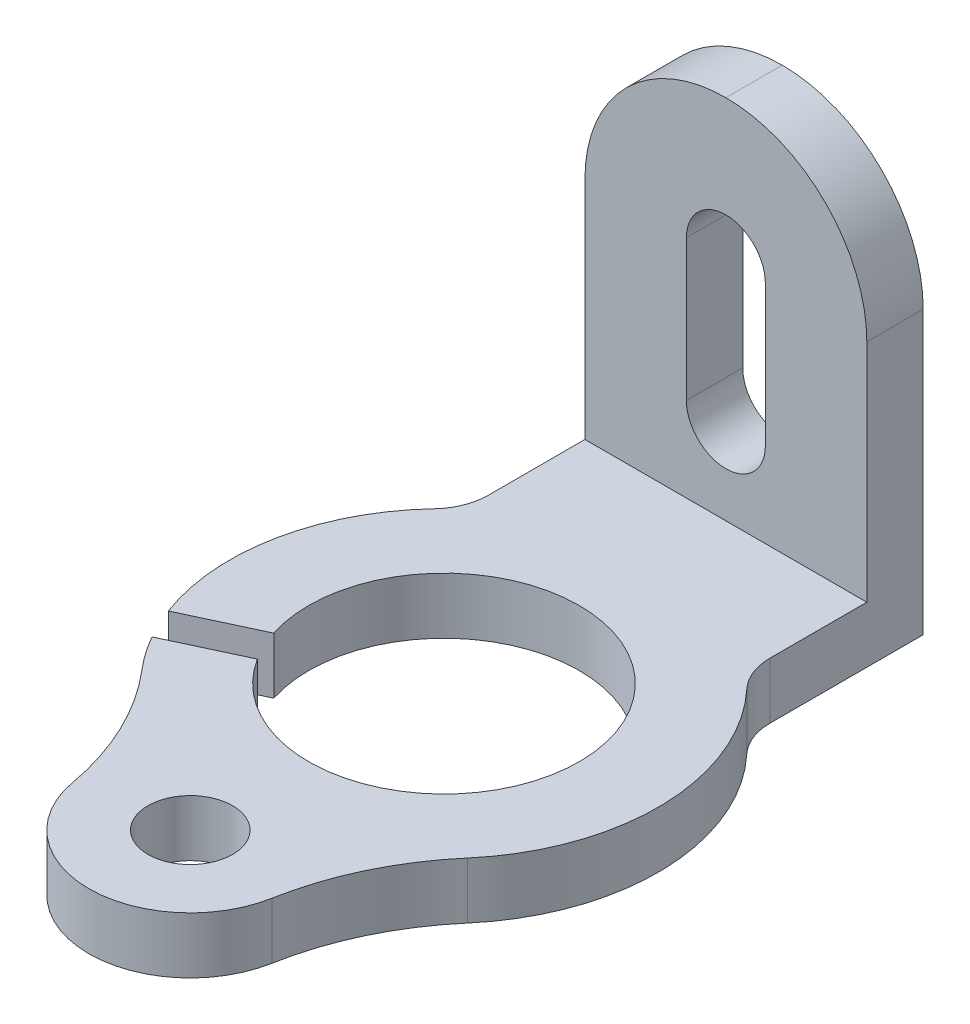
from build123d import *

# Parameters (mm, degrees)
SKETCH1_W           = 50
SKETCH1_H           = 10
SKETCH1_R           = 7.5
BOSS_EXTRUDE1_DEPTH = 10
SKETCH1_3_W         = 50
SKETCH1_3_H         = 10
BOSS_EXTRUDE2_DEPTH = 75
CUT_EXTRUDE1_DEPTH  = 10
FILLET1_R           = 25


with BuildPart() as part:
    # Sketch1 → Boss-Extrude1 (new body)
    # profile 1 of 3: a face of its own
    with BuildSketch(Plane(origin=(0, 0, 0), x_dir=(1, 0, 0), z_dir=(0, 1, 0))):
        with BuildLine():
            Line((25, -17.151864589), (25, 0))
            Line((25, 0), (-25, 0))
            Line((-25, 0), (-25, -17.151864589))
            ThreePointArc((-25, -17.151864589), (-25.701702665, -20.83176495), (-27.708333333, -23.995226133))
            ThreePointArc((-27.708333333, -23.995226133), (0, -12), (27.708333333, -23.995226133))
            ThreePointArc((27.708333333, -23.995226133), (25.701702665, -20.83176495), (25, -17.151864589))
        make_face()
    # profile 2 of 3: a face of its own
    with BuildSketch(Plane(origin=(0, 0, 0), x_dir=(1, 0, 0), z_dir=(0, 1, 0))):
        with Locations((0, 5)):
            Rectangle(SKETCH1_W, SKETCH1_H)
    # profile 3 of 3: a face of its own
    with BuildSketch(Plane(origin=(0, 0, 0), x_dir=(1, 0, 0), z_dir=(0, 1, 0))):
        with BuildLine():
            ThreePointArc((35.600057015, -63.29044546), (37.256095308, -42.517796957), (27.708333333, -23.995226133))
            ThreePointArc((27.708333333, -23.995226133), (0, -12), (-27.708333333, -23.995226133))
            ThreePointArc((-27.708333333, -23.995226133), (-37.256095308, -42.517796957), (-35.600057015, -63.29044546))
            Line((-35.600057015, -63.29044546), (-22.848639927, -57.34436202))
            ThreePointArc((-22.848639927, -57.34436202), (21.751386889, -39.857161718), (-20.312930357, -62.782208742))
            Line((-20.312930357, -62.782208742), (-33.064347445, -68.728292182))
            ThreePointArc((-33.064347445, -68.728292182), (-31.119955968, -71.807070885), (-28.889805354, -74.685606061))
            ThreePointArc((-28.889805354, -74.685606061), (-21.739686255, -85.712027428), (-17.709540124, -98.220588235))
            ThreePointArc((-17.709540124, -98.220588235), (0, -113), (17.709540124, -98.220588235))
            ThreePointArc((17.709540124, -98.220588235), (21.739686255, -85.712027428), (28.889805354, -74.685606061))
            ThreePointArc((28.889805354, -74.685606061), (31.119955968, -71.807070885), (33.064347445, -68.728292182))
            ThreePointArc((33.064347445, -68.728292182), (34.439695907, -66.059493946), (35.600057015, -63.29044546))
        make_face()
        with Locations(Location((0, -95, 0), (0, 0, 270))):
            Circle(SKETCH1_R, mode=Mode.SUBTRACT)
    extrude(amount=BOSS_EXTRUDE1_DEPTH)

    # Sketch1<3> → Boss-Extrude2 (add)
    with BuildSketch(Plane(origin=(0, 0, 0), x_dir=(1, 0, 0), z_dir=(0, 1, 0))):
        with Locations((0, 5)):
            Rectangle(SKETCH1_3_W, SKETCH1_3_H)
    extrude(amount=BOSS_EXTRUDE2_DEPTH)

    # Sketch2 → Cut-Extrude1 (cut)
    with BuildSketch(Plane.XY):
        with BuildLine():
            Line((7, 50), (7, 25))
            ThreePointArc((7, 25), (0, 18), (-7, 25))
            Line((-7, 25), (-7, 50))
            ThreePointArc((-7, 50), (0, 57), (7, 50))
        make_face()
    extrude(amount=-CUT_EXTRUDE1_DEPTH, mode=Mode.SUBTRACT)

    # Fillet1
    fillet1_edges = [part.edges().sort_by_distance(p)[0] for p in [
        (-25, 75, -5),
        (25, 75, -5),
    ]]
    fillet(fillet1_edges, radius=FILLET1_R - 0.0001)  # a hair under: the kernel refuses the full size


solid = part.part
